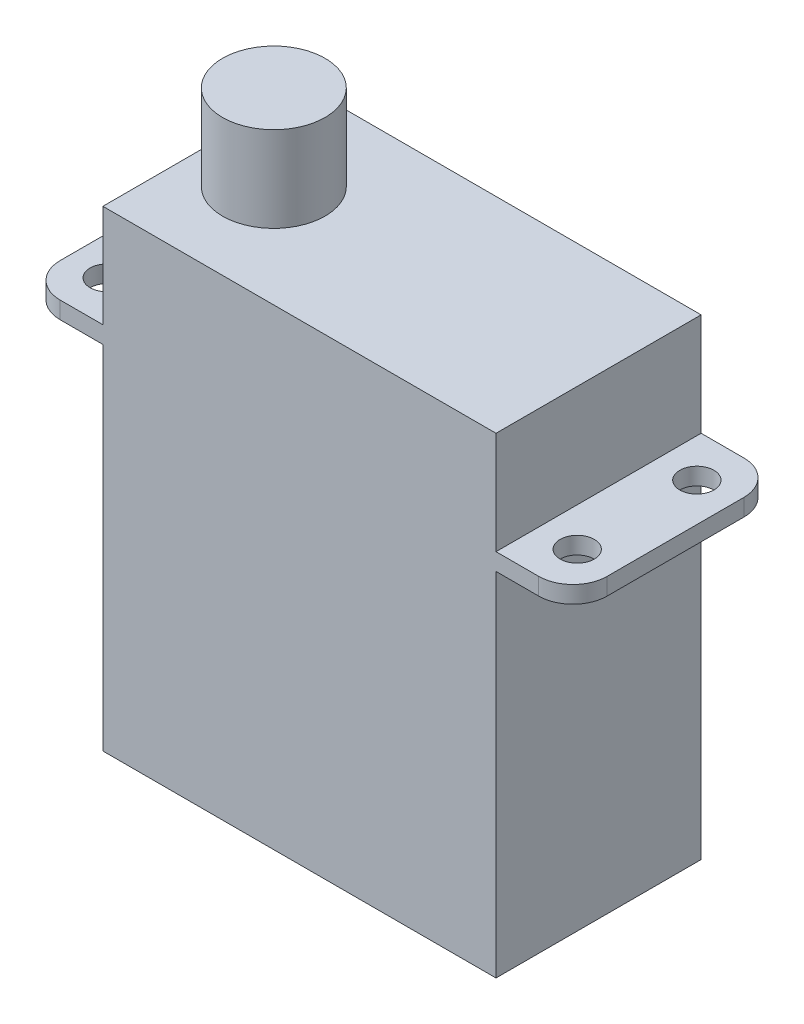
from build123d import *

# Parameters (mm, degrees)
EXTRUDE_1_DEPTH          = 6
SKETCH_2_R               = 3
EXTRUDE_2_DEPTH          = 5
CUT_EXTRUDE_1_DEPTH      = 28.541967976
CUT_EXTRUDE_1_DEPTH_BACK = 28.541967976
SKETCH_3_R               = 1
FILLET_1_R               = 2


with BuildPart() as part:
    # Эскиз1 → Бобышка-Вытянуть1 (new, symmetric)
    with BuildSketch(Plane.XY):
        Polygon((-11.5, 6.8), (-11.5, -13.8), (11.5, -13.8), (11.5, 6.8), (16, 6.8), (16, 7.8), (11.5, 7.8), (11.5, 13.8), (-11.5, 13.8), (-11.5, 7.8), (-16, 7.8), (-16, 6.8), align=None)
    extrude(amount=EXTRUDE_1_DEPTH, both=True)

    # Эскиз2 → Бобышка-Вытянуть2 (add)
    with BuildSketch(Plane(origin=(0, 13.8, 0), x_dir=(1, 0, 0), z_dir=(0, 1, 0))):
        with Locations((-7.5, 0)):
            Circle(SKETCH_2_R)
    extrude(amount=EXTRUDE_2_DEPTH)

    # Эскиз3 → Вырез-Вытянуть1 (cut, two sides: drawn at the far end of the back side and taken through both)
    with BuildSketch(Plane(origin=(0, 7.8, 0), x_dir=(1, 0, 0), z_dir=(0, 1, 0)).offset(-CUT_EXTRUDE_1_DEPTH_BACK)):
        with Locations((-13.75, 3.5)):
            Circle(SKETCH_3_R)
        with Locations((-13.75, -3.5)):
            Circle(SKETCH_3_R)
        with Locations((13.75, -3.5)):
            Circle(SKETCH_3_R)
        with Locations((13.75, 3.5)):
            Circle(SKETCH_3_R)
    extrude(amount=CUT_EXTRUDE_1_DEPTH + CUT_EXTRUDE_1_DEPTH_BACK, mode=Mode.SUBTRACT)

    # Скругление1
    fillet_1_edges = [part.edges().sort_by_distance(p)[0] for p in [
        (-16, 7.3, -6),
        (16, 7.3, -6),
        (16, 7.3, 6),
        (-16, 7.3, 6),
    ]]
    fillet(fillet_1_edges, radius=FILLET_1_R)


solid = part.part
